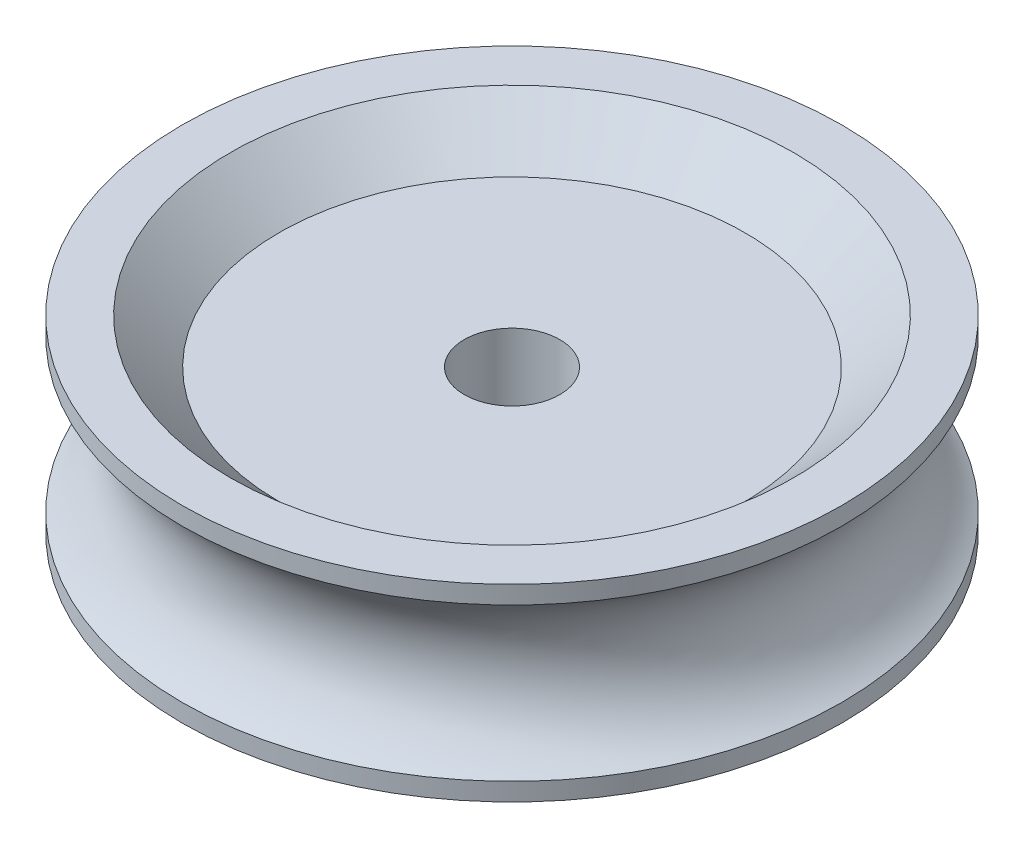
from build123d import *


with BuildPart() as part:
    # Эскиз1 → Повернуть1 (revolve)
    with BuildSketch(Plane.XY):
        with BuildLine():
            Line((8, 8.253336798), (8, -8.253336798))
            Line((8, -8.253336798), (39.012776084, -8.253336798))
            Line((39.012776084, -8.253336798), (47.18584368, -15.784752303))
            Line((47.18584368, -15.784752303), (55.230258483, -15.784752303))
            Line((55.230258483, -15.784752303), (55.230258483, -12.784752303))
            ThreePointArc((55.230258483, -12.784752303), (48.075646208, 0), (55.230258483, 12.784752303))
            Line((55.230258483, 12.784752303), (55.230258483, 15.784752303))
            Line((55.230258483, 15.784752303), (47.18584368, 15.784752303))
            Line((47.18584368, 15.784752303), (39.012776084, 8.253336798))
            Line((39.012776084, 8.253336798), (8, 8.253336798))
        make_face()
    revolve(axis=Axis((0, 40.932480583, 0), (0, -1, 0)))


solid = part.part
